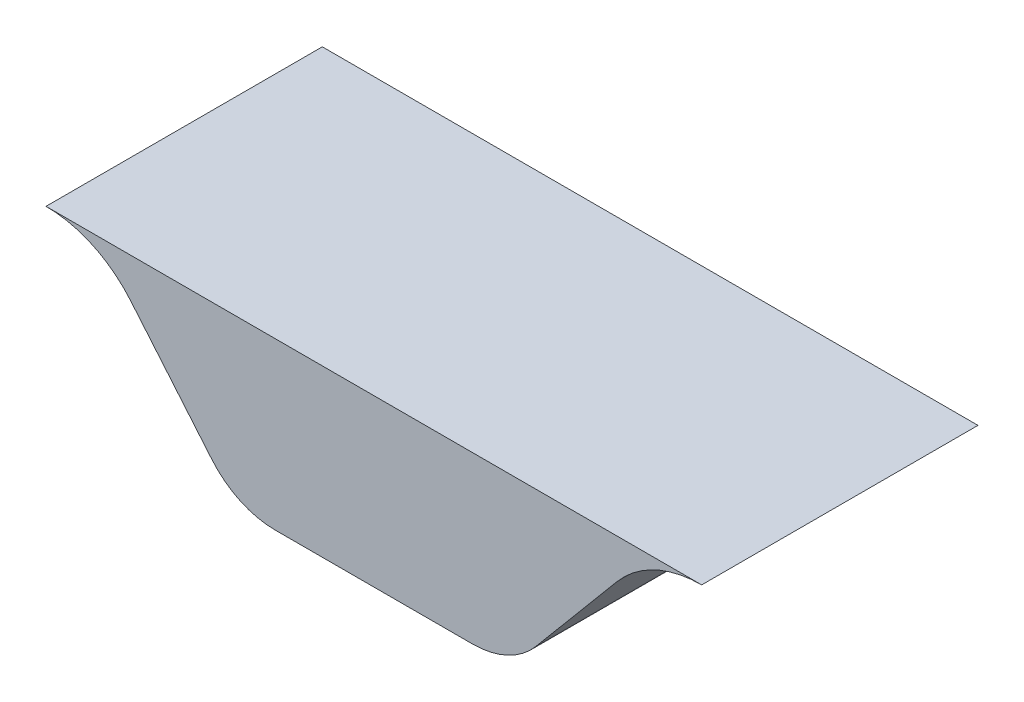
from build123d import *

# Parameters (mm, degrees)
SKETCH1_W           = 50
SKETCH1_H           = 5
BASE_EXTRUDE_DEPTH  = 25
BOSS_EXTRUDE1_DEPTH = 5
FILLET1_R           = 3
FILLET2_R           = 4
SKETCH3_W           = 50
SKETCH3_H           = 5
CUT_EXTRUDE1_DEPTH  = 57.222771187


with BuildPart() as part:
    # Sketch1 → Base-Extrude (new, symmetric)
    with BuildSketch(Plane.XY):
        with Locations((0, 2.5)):
            Rectangle(SKETCH1_W, SKETCH1_H)
    extrude(amount=BASE_EXTRUDE_DEPTH, both=True)

    # Sketch2 → Boss-Extrude1 (add, symmetric)
    with BuildSketch(Plane.XY):
        Polygon((-10, 0), (-4.965402213, -6), (4.965402213, -6), (10, 0), align=None)
    extrude(amount=BOSS_EXTRUDE1_DEPTH, both=True)

    # Fillet1
    fillet1_edges = [part.edges().sort_by_distance(p)[0] for p in [
        (4.965402213, -6, 0),
        (-4.965402213, -6, 0),
    ]]
    fillet(fillet1_edges, radius=FILLET1_R)

    # Fillet2
    fillet2_edges = [part.edges().sort_by_distance(p)[0] for p in [
        (10, 0, 0),
        (-10, 0, 0),
    ]]
    fillet(fillet2_edges, radius=FILLET2_R)

    # Sketch3 → Cut-Extrude1 (cut, through all)
    with BuildSketch(Plane(origin=(25, 0, 0), x_dir=(0, 0, -1), z_dir=(1, 0, 0))):
        with Locations((0, 2.5)):
            Rectangle(SKETCH3_W, SKETCH3_H)
    extrude(amount=-CUT_EXTRUDE1_DEPTH, mode=Mode.SUBTRACT)


solid = part.part
